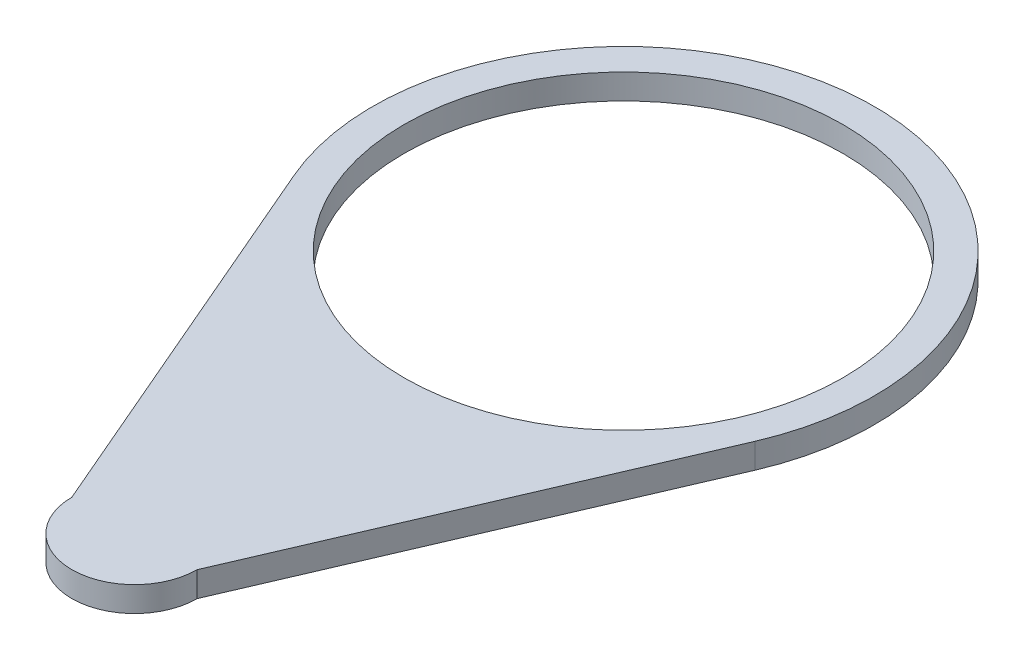
from build123d import *

# Parameters (mm, degrees)
SKETCH1_R           = 17.5
BOSS_EXTRUDE1_DEPTH = 2


with BuildPart() as part:
    # Sketch1 → Boss-Extrude1 (new body)
    with BuildSketch(Plane(origin=(0, 0, 0), x_dir=(1, 0, 0), z_dir=(0, 1, 0))):
        with BuildLine():
            Line((-18.373250306, 31.099134655), (-5, 0))
            ThreePointArc((-5, 0), (0, -5), (5, 0))
            Line((5, 0), (18.373250306, 31.099134655))
            ThreePointArc((18.373250306, 31.099134655), (0, 59), (-18.373250306, 31.099134655))
        make_face()
        with Locations((0, 39)):
            Circle(SKETCH1_R, mode=Mode.SUBTRACT)
    extrude(amount=BOSS_EXTRUDE1_DEPTH)


solid = part.part
